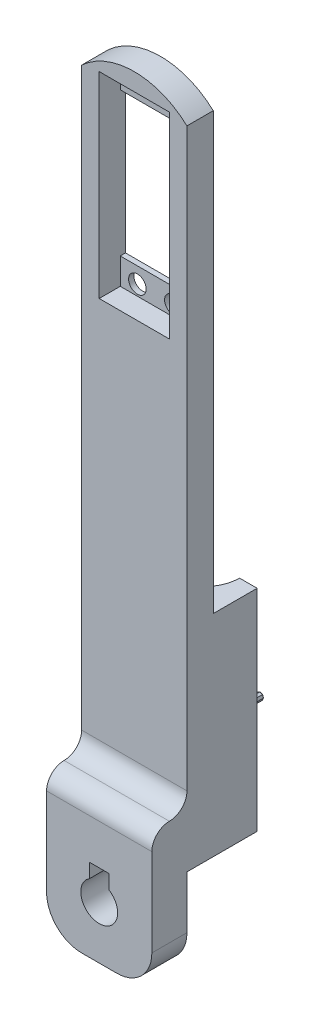
from build123d import *

# Parameters (mm, degrees)
SKETCH2_W                              = 30
SKETCH2_H                              = 30
BOSS_EXTRUDE1_DEPTH                    = 60
FILLET1_R                              = 10
SKETCH3_W                              = 40
SKETCH3_H                              = 25
CUT_EXTRUDE1_DEPTH                     = 69.738635424
SKETCH6_W                              = 30
SKETCH6_H                              = 40
BOSS_EXTRUDE2_DEPTH                    = 125
SKETCH7_W                              = 30
SKETCH7_H                              = 10
BOSS_EXTRUDE3_DEPTH                    = 10
FILLET2_START                          = -16
FILLET2_DEPTH                          = 32
FILLET2_START_2                        = -15
FILLET2_2_DEPTH                        = 30
SKETCH8_W                              = 25
SKETCH8_H                              = 70
CUT_EXTRUDE2_DEPTH                     = 156.241746963
SKETCH12_W                             = 30
SKETCH12_H                             = 7.5
BOSS_EXTRUDE4_DEPTH                    = 65
SKETCH13_W                             = 20
SKETCH13_H                             = 56
SERVO_HOLE_OUTER_DEPTH                 = 6
SKETCH20_R                             = 5
BOSS_EXTRUDE5_DEPTH                    = 44
FILLET_FOR_FOREARM_MOVEMENT_DEPTH      = 212.541958013
FILLET_FOR_FOREARM_MOVEMENT_DEPTH_BACK = 212.541958013
SKETCH19_R                             = 2.5
SKETCH19_W                             = 20
SKETCH19_H                             = 41
SERVO_HOLE_INNER_DEPTH                 = 26.5
MAKE_HALF_DEPTH                        = 225.629334512
ONE_MALE_JACK_DEPTH                    = 4
CHAMFER2_SIZE                          = 0.2
MALE_JACKS_COUNT                       = 2
MALE_JACKS_PITCH                       = 24
MALE_JACKS_COUNT_DIR2                  = 3
MALE_JACKS_PITCH_DIR2                  = 27
CHAMFER2_OF_MALE_JACKS_SIZE            = 0.2
ONE_FEMALE_JACK_DEPTH                  = 5
FEMALE_JACKS_COUNT                     = 2
FEMALE_JACKS_PITCH                     = 24
FEMALE_JACKS_COUNT_DIR2                = 3
FEMALE_JACKS_PITCH_DIR2                = 27
SKETCH26_R                             = 10
MAKE_LIGHER_DEPTH                      = 60


with BuildPart() as part:
    # Sketch2 → Boss-Extrude1 (new body)
    with BuildSketch(Plane.XY):
        Rectangle(SKETCH2_W, SKETCH2_H)
        with BuildLine():
            ThreePointArc((5.25, 0), (-2.561737691, -4.582575695), (-2.75, 4.472135955))
            Line((-2.75, 4.472135955), (-2.75, 8.5))
            Line((-2.75, 8.5), (0, 8.5))
            Line((0, 8.5), (2.75, 8.5))
            Line((2.75, 8.5), (2.75, 4.472135955))
            ThreePointArc((2.75, 4.472135955), (4.582575695, 2.561737691), (5.25, 0))
        make_face(mode=Mode.SUBTRACT)
    extrude(amount=BOSS_EXTRUDE1_DEPTH)

    # Fillet1
    fillet1_edges = [part.edges().sort_by_distance(p)[0] for p in [
        (15, -15, 30),
        (-15, -15, 30),
    ]]
    fillet(fillet1_edges, radius=FILLET1_R)

    # Sketch3 → Cut-Extrude1 (cut, through all)
    with BuildSketch(Plane.ZY.offset(15)):
        with Locations((30, -2.5)):
            Rectangle(SKETCH3_W, SKETCH3_H)
    extrude(amount=-CUT_EXTRUDE1_DEPTH, mode=Mode.SUBTRACT)

    # Sketch6 → Boss-Extrude2 (add)
    with BuildSketch(Plane(origin=(0, 15, 0), x_dir=(1, 0, 0), z_dir=(0, 1, 0))):
        with Locations((0, -30)):
            Rectangle(SKETCH6_W, SKETCH6_H)
    extrude(amount=BOSS_EXTRUDE2_DEPTH)

    # Sketch7 → Boss-Extrude3 (add)
    with BuildSketch(Plane(origin=(0, 15, 0), x_dir=(1, 0, 0), z_dir=(0, 1, 0))):
        with Locations((0, -5)):
            Rectangle(SKETCH7_W, SKETCH7_H)
        with Locations((0, -55)):
            Rectangle(SKETCH7_W, SKETCH7_H)
    extrude(amount=BOSS_EXTRUDE3_DEPTH)

    # Fillet2: read off the stored shape, not the designer's step
    # Fillet2 outline → Fillet2 (cut)
    with BuildSketch(Plane.YZ.offset(FILLET2_START)):
        with BuildLine():
            ThreePointArc((25, 5), (23.535533906, 1.464466094), (20, 0))
            Line((20, 0), (25, 0))
            Line((25, 0), (25, 5))
        make_face()
        with BuildLine():
            Line((25, 60), (20, 60))
            ThreePointArc((20, 60), (23.535533906, 58.535533906), (25, 55))
            Line((25, 55), (25, 60))
        make_face()
    extrude(amount=FILLET2_DEPTH, mode=Mode.SUBTRACT)

    # Fillet2 2 outline → Fillet2 2 (add)
    with BuildSketch(Plane.YZ.offset(FILLET2_START_2)):
        with BuildLine():
            Line((25, 10), (25, 5))
            ThreePointArc((25, 5), (26.464466094, 8.535533906), (30, 10))
            Line((30, 10), (25, 10))
        make_face()
        with BuildLine():
            ThreePointArc((30, 50), (26.464466094, 51.464466094), (25, 55))
            Line((25, 55), (25, 50))
            Line((25, 50), (30, 50))
        make_face()
    extrude(amount=FILLET2_2_DEPTH)

    # Sketch8 → Cut-Extrude2 (cut, through all)
    with BuildSketch(Plane(origin=(15, 0, 0), x_dir=(0, 0, -1), z_dir=(1, 0, 0))):
        with Locations((-30, 105)):
            Rectangle(SKETCH8_W, SKETCH8_H)
    extrude(amount=-CUT_EXTRUDE2_DEPTH, mode=Mode.SUBTRACT)

    # Sketch12 → Boss-Extrude4 (add)
    with BuildSketch(Plane(origin=(0, 140, 0), x_dir=(1, 0, 0), z_dir=(0, 1, 0))):
        with Locations((0, -13.75)):
            Rectangle(SKETCH12_W, SKETCH12_H)
        with Locations((0, -46.25)):
            Rectangle(SKETCH12_W, SKETCH12_H)
    extrude(amount=BOSS_EXTRUDE4_DEPTH)

    # Sketch13 → Servo Hole Outer (cut)
    with BuildSketch(Plane.XY.offset(50)):
        with Locations((0, 167)):
            Rectangle(SKETCH13_W, SKETCH13_H)
    extrude(amount=-SERVO_HOLE_OUTER_DEPTH, mode=Mode.SUBTRACT)

    # Sketch20 → Boss-Extrude5 (add)
    with BuildSketch(Plane.XY.offset(44)):
        with Locations(Location((0, 178, 0), (0, 0, 90))):
            Circle(SKETCH20_R)
    extrude(amount=-BOSS_EXTRUDE5_DEPTH)

    # Sketch23 → Fillet for Forearm Movement (cut, two sides: drawn at the far end of the back side and taken through both)
    with BuildSketch(Plane(origin=(0, 0, 10), x_dir=(-1, 0, 0), z_dir=(0, 0, -1)).offset(-FILLET_FOR_FOREARM_MOVEMENT_DEPTH_BACK)):
        with BuildLine():
            Line((-15, 194.093476939), (-15, 205))
            Line((-15, 205), (15, 205))
            Line((15, 205), (15, 194.093476939))
            ThreePointArc((15, 194.093476939), (0, 200), (-15, 194.093476939))
        make_face()
    extrude(amount=FILLET_FOR_FOREARM_MOVEMENT_DEPTH + FILLET_FOR_FOREARM_MOVEMENT_DEPTH_BACK, mode=Mode.SUBTRACT)

    # Sketch19 → Servo Hole Inner (cut)
    with BuildSketch(Plane.XY.offset(44)):
        with Locations((-5.12, 192)):
            Circle(SKETCH19_R)
        with Locations(Location((5.12, 192, 0), (0, 0, 270))):
            Circle(SKETCH19_R)
        with Locations((5.12, 142)):
            Circle(SKETCH19_R)
        with Locations(Location((-5.12, 142, 0), (0, 0, 270))):
            Circle(SKETCH19_R)
        with Locations((0, 167)):
            Rectangle(SKETCH19_W, SKETCH19_H)
    extrude(amount=-SERVO_HOLE_INNER_DEPTH, mode=Mode.SUBTRACT)

    # 3DSketch2 → Make Half (cut, through all)
    with BuildSketch(Plane(origin=(-16.97773478, -20.308334844, 30), x_dir=(0.14055892995616934, 0.9900723141314359, 0), z_dir=(0, 0, 1))):
        Polygon((0, 0), (4.55547701, -32.087976668), (230.577525736, 0), (226.022048726, 32.087976668), align=None)
    extrude(amount=-MAKE_HALF_DEPTH, mode=Mode.SUBTRACT)

    # Sketch24 → One Male Jack (add)
    with BuildSketch(Plane(origin=(0, 0, 30), x_dir=(-1, 0, 0), z_dir=(0, 0, -1))):
        Polygon((13, 67), (12.707106781, 67.707106781), (12, 68), (11.292893219, 67.707106781), (11, 67), (11.292893219, 66.292893219), (12, 66), (12.707106781, 66.292893219), align=None)
    one_male_jack = extrude(amount=ONE_MALE_JACK_DEPTH)

    # Chamfer2
    chamfer2_edges = [part.edges().sort_by_distance(p)[0] for p in [
        (-12.853553391, 66.646446609, 26),
        (-12.853553391, 67.353553391, 26),
        (-12.353553391, 67.853553391, 26),
        (-11.646446609, 67.853553391, 26),
        (-11.146446609, 67.353553391, 26),
        (-11.146446609, 66.646446609, 26),
        (-11.646446609, 66.146446609, 26),
        (-12.353553391, 66.146446609, 26),
    ]]
    chamfer(chamfer2_edges, length=CHAMFER2_SIZE)

    # Male Jacks: One Male Jack 2 × 3, 3 skipped
    with Locations(*[(i * MALE_JACKS_PITCH, -j * MALE_JACKS_PITCH_DIR2, 0) for i in range(MALE_JACKS_COUNT) for j in range(MALE_JACKS_COUNT_DIR2) if (i, j) not in ((0, 0), (0, 1), (1, 0), (1, 2))]):
        add(one_male_jack)

    # Chamfer2 of Male Jacks
    chamfer2_of_male_jacks_edges = [part.edges().sort_by_distance(p)[0] for p in [
        (-12.853553391, 12.646446609, 26),
        (-12.853553391, 13.353553391, 26),
        (-12.353553391, 13.853553391, 26),
        (-11.646446609, 13.853553391, 26),
        (-11.146446609, 13.353553391, 26),
        (-11.146446609, 12.646446609, 26),
        (-11.646446609, 12.146446609, 26),
        (-12.353553391, 12.146446609, 26),
        (11.146446609, 39.646446609, 26),
        (11.146446609, 40.353553391, 26),
        (11.646446609, 40.853553391, 26),
        (12.353553391, 40.853553391, 26),
        (12.853553391, 40.353553391, 26),
        (12.853553391, 39.646446609, 26),
        (12.353553391, 39.146446609, 26),
        (11.646446609, 39.146446609, 26),
    ]]
    chamfer(chamfer2_of_male_jacks_edges, length=CHAMFER2_OF_MALE_JACKS_SIZE)

    # Sketch25 → One Female Jack (cut)
    with BuildSketch(Plane(origin=(0, 0, 30), x_dir=(-1, 0, 0), z_dir=(0, 0, -1))):
        Polygon((-12, 68.025), (-12.724784451, 67.724784451), (-13.025, 67), (-12.724784451, 66.275215549), (-12, 65.975), (-11.275215549, 66.275215549), (-10.975, 67), (-11.275215549, 67.724784451), align=None)
    one_female_jack = extrude(amount=-ONE_FEMALE_JACK_DEPTH, mode=Mode.SUBTRACT)

    # Female Jacks: One Female Jack 2 × 3, 3 skipped
    with Locations(*[(-i * FEMALE_JACKS_PITCH, -j * FEMALE_JACKS_PITCH_DIR2, 0) for i in range(FEMALE_JACKS_COUNT) for j in range(FEMALE_JACKS_COUNT_DIR2) if (i, j) not in ((0, 0), (0, 1), (1, 0), (1, 2))]):
        add(one_female_jack, mode=Mode.SUBTRACT)

    # Sketch26 → Make Ligher (cut)
    with BuildSketch(Plane.XZ.offset(-10)):
        with Locations((0, 30)):
            Circle(SKETCH26_R)
    extrude(amount=-MAKE_LIGHER_DEPTH, mode=Mode.SUBTRACT)


solid = part.part
